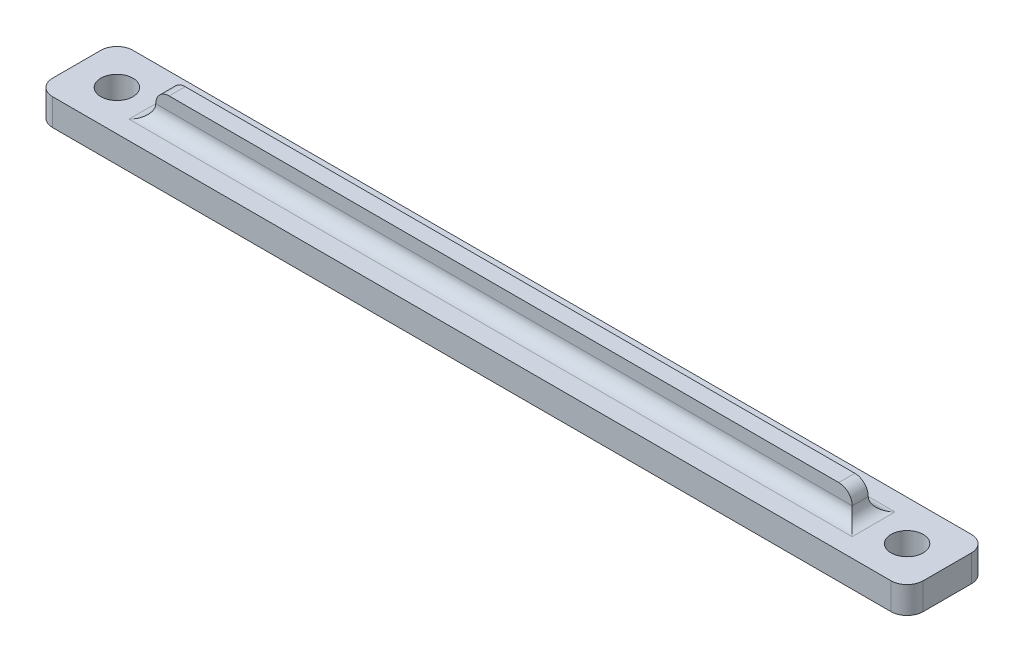
from build123d import *

# Parameters (mm, degrees)
SKETCH1_W           = 65
SKETCH1_H           = 6
BOSS_EXTRUDE1_DEPTH = 2
SKETCH2_R           = 1.2
CUT_EXTRUDE1_DEPTH  = 66.306967469
SKETCH3_W           = 52
SKETCH3_H           = 1.2
BOSS_EXTRUDE2_DEPTH = 2
FILLET1_R           = 1.2
FILLET3_R           = 1
FILLET4_R           = 1
FILLET5_R           = 1
SKETCH4_R           = 2.15
SKETCH4_R_2         = 1.55
CUT_EXTRUDE2_DEPTH  = 0.8


with BuildPart() as part:
    # Sketch1 → Boss-Extrude1 (new body)
    with BuildSketch(Plane(origin=(0, 0, 0), x_dir=(1, 0, 0), z_dir=(0, 1, 0))):
        with Locations((32.5, -3)):
            Rectangle(SKETCH1_W, SKETCH1_H)
    extrude(amount=BOSS_EXTRUDE1_DEPTH)

    # Sketch2 → Cut-Extrude1 (cut, through all)
    with BuildSketch(Plane(origin=(0, 2, 0), x_dir=(1, 0, 0), z_dir=(0, 1, 0))):
        with Locations(Location((62, -3, 0), (0, 0, 270))):
            Circle(SKETCH2_R)
        with Locations(Location((3, -3, 0), (0, 0, 270))):
            Circle(SKETCH2_R)
    extrude(amount=-CUT_EXTRUDE1_DEPTH, mode=Mode.SUBTRACT)

    # Sketch3 → Boss-Extrude2 (add)
    with BuildSketch(Plane(origin=(0, 2, 0), x_dir=(1, 0, 0), z_dir=(0, 1, 0))):
        with Locations((32.5, -3)):
            Rectangle(SKETCH3_W, SKETCH3_H)
    extrude(amount=BOSS_EXTRUDE2_DEPTH)

    # Fillet1
    fillet1_edges = [part.edges().sort_by_distance(p)[0] for p in [
        (0, 1, 0),
        (65, 1, 0),
        (65, 1, 6),
        (0, 1, 6),
    ]]
    fillet(fillet1_edges, radius=FILLET1_R)

    # Fillet3
    fillet3_edges = [part.edges().sort_by_distance(p)[0] for p in [
        (6.5, 4, 3),
        (58.5, 4, 3),
    ]]
    fillet(fillet3_edges, radius=FILLET3_R)

    # Fillet4
    fillet4_edges = [part.edges().sort_by_distance(p)[0] for p in [
        (32.5, 2, 3.6),
        (32.5, 2, 2.4),
    ]]
    fillet(fillet4_edges, radius=FILLET4_R)

    # Fillet5
    fillet5_edges = [part.edges().sort_by_distance(p)[0] for p in [
        (58.5, 2, 3),
        (6.5, 2, 3),
    ]]
    fillet(fillet5_edges, radius=FILLET5_R - 0.0001)  # a hair under: the kernel refuses the full size

    # Sketch4 → Cut-Extrude2 (cut)
    # profile 1 of 2: a face of its own
    with BuildSketch(Plane(origin=(0, 0, 0), x_dir=(-1, 0, 0), z_dir=(0, -1, 0))):
        with Locations(Location((-20, -3, 0), (0, 0, 90))):
            Circle(SKETCH4_R)
        with Locations(Location((-20, -3, 0), (0, 0, 90))):
            Circle(SKETCH4_R_2, mode=Mode.SUBTRACT)
    # profile 2 of 2: a face of its own
    with BuildSketch(Plane(origin=(0, 0, 0), x_dir=(-1, 0, 0), z_dir=(0, -1, 0))):
        with Locations(Location((-45, -3, 0), (0, 0, 90))):
            Circle(SKETCH4_R)
        with Locations(Location((-45, -3, 0), (0, 0, 90))):
            Circle(SKETCH4_R_2, mode=Mode.SUBTRACT)
    extrude(amount=-CUT_EXTRUDE2_DEPTH, mode=Mode.SUBTRACT)


solid = part.part
